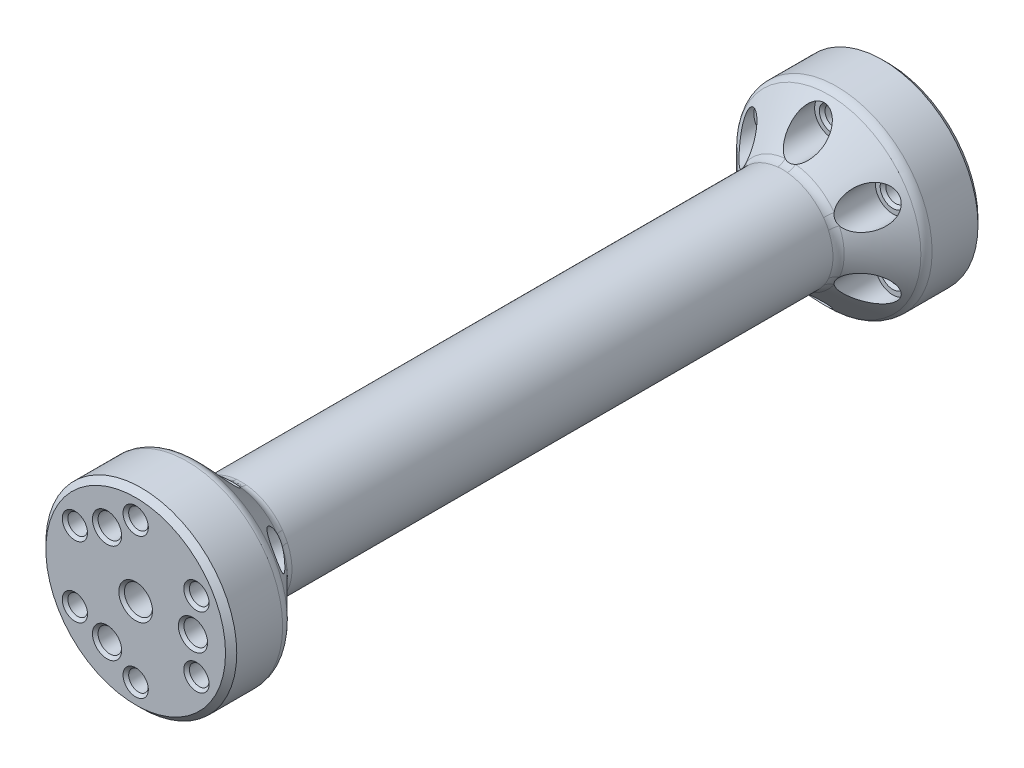
from build123d import *

# Parameters (mm, degrees)
EXTRUDE_1_DEPTH          = 67
EXTRUDE_1_DEPTH_BACK     = 67
SKETCH_1_R               = 17
SKETCH_2_R               = 1.75
CUT_EXTRUDE_1_DEPTH      = 137.1396342
SKETCH_3_R               = 2.1
CUT_EXTRUDE_2_DEPTH      = 6
SKETCH_4_R               = 2.5
CUT_EXTRUDE_3_DEPTH      = 137.139634323
CHAMFER_4_SIZE           = 0.5
CUT_EXTRUDE_5_DEPTH      = 57
CUT_EXTRUDE_5_DEPTH_BACK = 57
SKETCH_7_R               = 3.1
CHAMFER_6_SIZE           = 0.5
CHAMFER_7_SIZE           = 1
FILLET_1_R               = 2


with BuildPart() as part:
    # 草图1 → 凸台-拉伸1 (new, two sides: drawn at the far end of the back side and taken through both)
    with BuildSketch(Plane.XY.offset(-EXTRUDE_1_DEPTH_BACK)):
        Circle(SKETCH_1_R)
    extrude(amount=EXTRUDE_1_DEPTH + EXTRUDE_1_DEPTH_BACK)

    # 草图6 → 切除-旋转1 (revolve, cut)
    with BuildSketch(Plane(origin=(0, 0, 0), x_dir=(1, 0, 0), z_dir=(0, 1, 0)), mode=Mode.PRIVATE) as cut_revolve_1_sk:
        Polygon((17, 57), (9, 49), (9, -49), (17, -57), align=None)
    revolve(cut_revolve_1_sk.sketch.rotate(Axis((0, 0, -67), (0, 0, 1)), 180), axis=Axis((0, 0, -67), (0, 0, 1)), mode=Mode.SUBTRACT)

    # 草图2 → 切除-拉伸1 (cut, through all)
    with BuildSketch(Plane.XY.offset(67)):
        with Locations((0, 12.5)):
            Circle(SKETCH_2_R)
        with Locations((10.825317547, 6.25)):
            Circle(SKETCH_2_R)
        with Locations((10.825317547, -6.25)):
            Circle(SKETCH_2_R)
        with Locations((0, -12.5)):
            Circle(SKETCH_2_R)
        with Locations((-10.825317547, -6.25)):
            Circle(SKETCH_2_R)
        with Locations((-10.825317547, 6.25)):
            Circle(SKETCH_2_R)
    extrude(amount=-CUT_EXTRUDE_1_DEPTH, mode=Mode.SUBTRACT)

    # 草图3 → 切除-拉伸2 (cut)
    with BuildSketch(Plane.XY.offset(67)):
        with Locations((-5.1, 8.833459119)):
            Circle(SKETCH_3_R)
        with Locations((10.2, 0)):
            Circle(SKETCH_3_R)
        with Locations((-5.1, -8.833459119)):
            Circle(SKETCH_3_R)
    cut_extrude_2 = extrude(amount=-CUT_EXTRUDE_2_DEPTH, mode=Mode.SUBTRACT)

    # 草图4 → 切除-拉伸3 (cut, through all)
    with BuildSketch(Plane.XY.offset(67)):
        Circle(SKETCH_4_R)
    extrude(amount=-CUT_EXTRUDE_3_DEPTH, mode=Mode.SUBTRACT)

    # 倒角4
    chamfer_4_edges = [part.edges().sort_by_distance(p)[0] for p in [
        (-7.2, 8.833459119, 67),
        (8.1, 0, 67),
        (-7.2, -8.833459119, 67),
    ]]
    chamfer(chamfer_4_edges, length=CHAMFER_4_SIZE)

    # 镜向1: 切除-拉伸2 across plane
    add(cut_extrude_2.mirror(Plane.XY), mode=Mode.SUBTRACT)

    # 草图7 → 切除-拉伸5 (cut, two sides: drawn at the far end of the back side and taken through both)
    with BuildSketch(Plane.XY.offset(-CUT_EXTRUDE_5_DEPTH_BACK)):
        with Locations((0, 12.5)):
            Circle(SKETCH_7_R)
        with Locations((10.825317547, 6.25)):
            Circle(SKETCH_7_R)
        with Locations((10.825317547, -6.25)):
            Circle(SKETCH_7_R)
        with Locations((0, -12.5)):
            Circle(SKETCH_7_R)
        with Locations((-10.825317547, -6.25)):
            Circle(SKETCH_7_R)
        with Locations((-10.825317547, 6.25)):
            Circle(SKETCH_7_R)
    extrude(amount=CUT_EXTRUDE_5_DEPTH + CUT_EXTRUDE_5_DEPTH_BACK, mode=Mode.SUBTRACT)

    # 倒角6
    chamfer_6_edges = [part.edges().sort_by_distance(p)[0] for p in [
        (-1.75, 12.5, 57),
        (-1.75, 12.5, -57),
        (-12.575317547, 6.25, 57),
        (-12.575317547, 6.25, -57),
        (-12.575317547, -6.25, 57),
        (-12.575317547, -6.25, -57),
        (-1.75, -12.5, 57),
        (-1.75, -12.5, -57),
        (9.075317547, -6.25, 57),
        (9.075317547, -6.25, -57),
        (9.075317547, 6.25, 57),
        (9.075317547, 6.25, -57),
        (-1.75, 12.5, -67),
        (-1.75, 12.5, 67),
        (-12.575317547, 6.25, -67),
        (-12.575317547, 6.25, 67),
        (-12.575317547, -6.25, -67),
        (-12.575317547, -6.25, 67),
        (-1.75, -12.5, -67),
        (-1.75, -12.5, 67),
        (9.075317547, -6.25, -67),
        (9.075317547, -6.25, 67),
        (9.075317547, 6.25, -67),
        (9.075317547, 6.25, 67),
        (-2.5, 0, -67),
        (-2.5, 0, 67),
    ]]
    chamfer(chamfer_6_edges, length=CHAMFER_6_SIZE)

    # 倒角7
    chamfer_7_edges = [part.edges().sort_by_distance(p)[0] for p in [
        (-17, 0, 67),
        (-17, 0, -67),
    ]]
    chamfer(chamfer_7_edges, length=CHAMFER_7_SIZE)

    # 圆角1
    fillet_1_edges = [part.edges().sort_by_distance(p)[0] for p in [
        (9, 0, 49),
        (9, 0, -49),
        (0, -17, -57),
        (0, -17, 57),
    ]]
    fillet(fillet_1_edges, radius=FILLET_1_R)


solid = part.part
